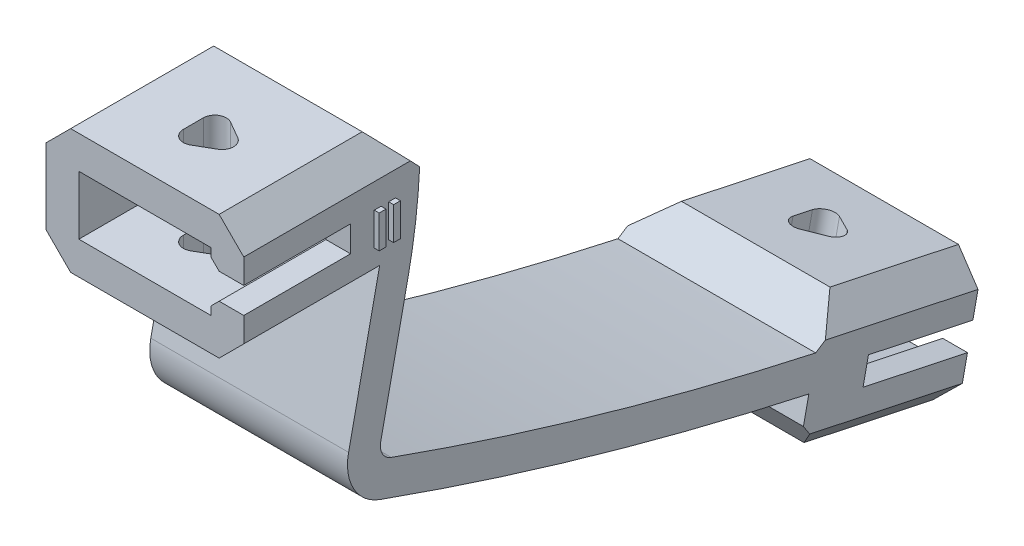
from build123d import *

# Parameters (mm, degrees)
SKETCH1_W                      = 12.04
SKETCH1_H                      = 7.58
SKETCH1_W_2                    = 8.04
SKETCH1_H_2                    = 3.58
BOSS_EXTRUDE1_DEPTH            = 8
SKETCH1_2_W                    = 12.04
SKETCH1_2_H                    = 7.58
SKETCH1_2_W_2                  = 8.04
SKETCH1_2_H_2                  = 3.58
BOSS_EXTRUDE2_DEPTH            = 2
EXTRUDE_THIN1_DEPTH            = 12.04
SKETCH5_W                      = 12.04
SKETCH5_H                      = 7.58
SKETCH5_W_2                    = 8.04
SKETCH5_H_2                    = 3.58
BOSS_EXTRUDE4_DEPTH            = 8
SKETCH5_4_W                    = 12.04
SKETCH5_4_H                    = 7.58
BOSS_EXTRUDE5_DEPTH            = 2
CHAMFER1_SIZE                  = 1.5
CHAMFER2_START                 = -7
CHAMFER2_DEPTH                 = 14
CUT_EXTRUDE1_REACH             = 50.973
CUT_EXTRUDE1_DIRECTION_2_DEPTH = 49.973440368
CUT_EXTRUDE2_DEPTH             = 48.541116576
CUT_EXTRUDE2_DEPTH_BACK        = 48.541116576
SKETCH8_W                      = 2
SKETCH8_H                      = 1.58
CUT_EXTRUDE3_DEPTH             = 6.5
SKETCH9_W                      = 4
SKETCH9_H                      = 1.58
CUT_EXTRUDE4_DEPTH             = 6.5
CHAMFER3_SIZE                  = 0.5
SKETCH10_W                     = 0.414634146
SKETCH10_H                     = 2
SKETCH10_W_2                   = 0.414634147
BOSS_EXTRUDE6_DEPTH            = 0.3


with BuildPart() as part:
    # Sketch1 → Boss-Extrude1 (new body)
    with BuildSketch(Plane.XY):
        Rectangle(SKETCH1_W, SKETCH1_H)
        Rectangle(SKETCH1_W_2, SKETCH1_H_2, mode=Mode.SUBTRACT)
    extrude(amount=BOSS_EXTRUDE1_DEPTH)

    # Sketch1<2> → Boss-Extrude2 (add)
    # profile 1 of 2: a face of its own
    with BuildSketch(Plane.XY):
        Rectangle(SKETCH1_2_W, SKETCH1_2_H)
        Rectangle(SKETCH1_2_W_2, SKETCH1_2_H_2, mode=Mode.SUBTRACT)
    # profile 2 of 2: a face of its own
    with BuildSketch(Plane.XY):
        Rectangle(SKETCH1_2_W_2, SKETCH1_2_H_2)
    extrude(amount=-BOSS_EXTRUDE2_DEPTH)

    # Sketch3 → Extrude-Thin1 (add)
    with BuildSketch(Plane(origin=(6.02, 9.81, 0), x_dir=(0, -1, 0), z_dir=(1, 0, 0))):
        with BuildLine():
            Line((6.02, 2.744137986), (6.52, 2.744137986))
            ThreePointArc((6.52, 2.744137986), (10.07949931, 2.557592532), (13.6, 2))
            Line((13.6, 2), (21.425180806, 0.336706473))
            ThreePointArc((21.425180806, 0.336706473), (22.120268588, 0.441550315), (22.574623539, 0.977927827))
            ThreePointArc((22.574623539, 0.977927827), (26.849152106, 14.317688881), (30.219561316, 27.914054616))
            Line((30.219561316, 27.914054616), (30.401286915, 28.769006338))
            Line((30.401286915, 28.769006338), (32.357582116, 28.353182957))
            Line((32.357582116, 28.353182957), (32.175856518, 27.498231234))
            ThreePointArc((32.175856518, 27.498231234), (28.773161162, 13.771621897), (24.457685624, 0.304075332))
            ThreePointArc((24.457685624, 0.304075332), (23.094620772, -1.305057203), (21.009357424, -1.619588728))
            Line((21.009357424, -1.619588728), (13.184176618, 0.043704799))
            ThreePointArc((13.184176618, 0.043704799), (9.870442383, 0.568548741), (6.52, 0.744137986))
            Line((6.52, 0.744137986), (6.02, 0.744137986))
            Line((6.02, 0.744137986), (6.02, 2.744137986))
        make_face()
    extrude(amount=-EXTRUDE_THIN1_DEPTH)



with BuildPart() as body_2:
    # Sketch5 → Boss-Extrude4 (new body)
    with BuildSketch(Plane(origin=(0, 484.189145571, -136.063399466), x_dir=(1, 0, 0), z_dir=(0, -0.20791169081775487, -0.9781476007338067))):
        with Locations((0, 517.847527624)):
            Rectangle(SKETCH5_W, SKETCH5_H)
        with Locations((0, 517.847527624)):
            Rectangle(SKETCH5_W_2, SKETCH5_H_2, mode=Mode.SUBTRACT)
    extrude(amount=BOSS_EXTRUDE4_DEPTH)


with BuildPart() as part_1:
    add(part.part)

    add(body_2.part)  # Boss-Extrude5 merges body 2
    # Sketch5<4> → Boss-Extrude5 (add)
    with BuildSketch(Plane(origin=(0, 484.189145571, -136.063399466), x_dir=(1, 0, 0), z_dir=(0, -0.20791169081775487, -0.9781476007338067))):
        with Locations((0, 517.847527624)):
            Rectangle(SKETCH5_4_W, SKETCH5_4_H)
    extrude(amount=-BOSS_EXTRUDE5_DEPTH)

    # Chamfer1
    chamfer1_edges = [part_1.edges().sort_by_distance(p)[0] for p in [
        (6.02, -26.673085599, -30.543301906),
        (-6.02, -26.673085599, -30.543301906),
        (6.02, 3.79, 2.627931007),
        (6.02, -3.79, 4.022340595),
        (-6.02, -3.79, 4.022340595),
        (-6.02, 3.79, 2.627931007),
        (6.02, -19.258726786, -32.119272522),
        (-6.02, -19.258726786, -32.119272522),
    ]]
    chamfer(chamfer1_edges, length=CHAMFER1_SIZE)

    # Chamfer2: read off the stored shape, not the designer's step
    # Chamfer2 outline → Chamfer2 (cut)
    with BuildSketch(Plane.YZ.offset(CHAMFER2_START)):
        with BuildLine():
            Line((3.79, -2.744137986), (3.79, -0.709020541))
            Line((3.79, -0.709020541), (1.696404781, -2.706829325))
            ThreePointArc((1.696404781, -2.706829325), (2.492984056, -2.734809543), (3.29, -2.744137986))
            Line((3.29, -2.744137986), (3.79, -2.744137986))
        make_face()
        Polygon((-25.633527145, -25.652563902), (-26.049350527, -27.608859104), (-23.677231944, -26.068387284), align=None)
        with BuildLine():
            ThreePointArc((-20.172493797, -26.813342374), (-20.172815684, -26.814817596), (-20.173137561, -26.81629282))
            Line((-20.173137561, -26.81629282), (-18.634991713, -29.18482972))
            Line((-18.634991713, -29.18482972), (-18.219168332, -27.228534519))
            Line((-18.219168332, -27.228534519), (-20.172493797, -26.813342374))
        make_face()
    extrude(amount=CHAMFER2_DEPTH, mode=Mode.SUBTRACT)

    # Cut-Extrude1: up to this face of the body (flat: up to its plane)
    cut_extrude1_end = Plane(part_1.part.faces().sort_by_distance((0, -3.79, 4.022340595))[0])
    # Sketch6 → Cut-Extrude1 (cut, up to the picked face)
    with BuildSketch(Plane(origin=(0, 3.79, 0), x_dir=(1, 0, 0), z_dir=(0, 1, 0)), mode=Mode.PRIVATE) as cut_extrude1_sk1:
        with BuildLine():
            Line((1.05, -3.393782217), (0, -2.787564435))
            ThreePointArc((0, -2.787564435), (-0.7, -2.787564435), (-1.05, -3.393782217))
            Line((-1.05, -3.393782217), (-1.05, -4.606217783))
            ThreePointArc((-1.05, -4.606217783), (-0.7, -5.212435565), (0, -5.212435565))
            Line((0, -5.212435565), (1.05, -4.606217783))
            ThreePointArc((1.05, -4.606217783), (1.4, -4), (1.05, -3.393782217))
        make_face()
    cut_extrude1_tool1 = split(extrude(cut_extrude1_sk1.sketch, amount=-CUT_EXTRUDE1_REACH, mode=Mode.PRIVATE), bisect_by=cut_extrude1_end, keep=Keep.BOTH, mode=Mode.PRIVATE)
    add(cut_extrude1_tool1.solids().sort_by(Axis((0, 3.79, 4), (0, -1, 0)))[0], mode=Mode.SUBTRACT)

    # Sketch6 → Cut-Extrude1 direction 2 (cut)
    with BuildSketch(Plane(origin=(0, 3.79, 0), x_dir=(1, 0, 0), z_dir=(0, 1, 0))):
        with BuildLine():
            Line((1.05, -3.393782217), (0, -2.787564435))
            ThreePointArc((0, -2.787564435), (-0.7, -2.787564435), (-1.05, -3.393782217))
            Line((-1.05, -3.393782217), (-1.05, -4.606217783))
            ThreePointArc((-1.05, -4.606217783), (-0.7, -5.212435565), (0, -5.212435565))
            Line((0, -5.212435565), (1.05, -4.606217783))
            ThreePointArc((1.05, -4.606217783), (1.4, -4), (1.05, -3.393782217))
        make_face()
    extrude(amount=CUT_EXTRUDE1_DIRECTION_2_DEPTH, mode=Mode.SUBTRACT)

    # Sketch7 → Cut-Extrude2 (cut, two sides: drawn at the far end of the back side and taken through both)
    with BuildSketch(Plane(origin=(0, -19.308540852, 4.104157054), x_dir=(1, 0, 0), z_dir=(0, -0.9781476007338067, 0.2079116908177549)).offset(-CUT_EXTRUDE2_DEPTH_BACK)):
        with BuildLine():
            Line((1.05, -35.815286021), (0, -35.209068239))
            ThreePointArc((0, -35.209068239), (-0.7, -35.209068239), (-1.05, -35.815286021))
            Line((-1.05, -35.815286021), (-1.05, -37.027721587))
            ThreePointArc((-1.05, -37.027721587), (-0.7, -37.633939369), (0, -37.633939369))
            Line((0, -37.633939369), (1.05, -37.027721587))
            ThreePointArc((1.05, -37.027721587), (1.4, -36.421503804), (1.05, -35.815286021))
        make_face()
    extrude(amount=CUT_EXTRUDE2_DEPTH + CUT_EXTRUDE2_DEPTH_BACK, mode=Mode.SUBTRACT)

    # Sketch8 → Cut-Extrude3 (cut)
    with BuildSketch(Plane.XY.offset(8)):
        with Locations((5.02, 0)):
            Rectangle(SKETCH8_W, SKETCH8_H)
    extrude(amount=-CUT_EXTRUDE3_DEPTH, mode=Mode.SUBTRACT)

    # Sketch9 → Cut-Extrude4 (cut)
    with BuildSketch(Plane(origin=(0, -8.404103201, -39.538196964), x_dir=(-1, 0, 0), z_dir=(0, -0.20791169081775673, -0.9781476007338064))):
        with Locations((-6.02, -15.949905141)):
            Rectangle(SKETCH9_W, SKETCH9_H)
    extrude(amount=-CUT_EXTRUDE4_DEPTH, mode=Mode.SUBTRACT)

    # Chamfer3
    chamfer3_edges = [part_1.edges().sort_by_distance(p)[0] for p in [
        (4.02, -0.79, 4.75),
        (4.02, 0.79, 4.75),
        (4.02, 0, 1.5),
        (4.02, -24.102488256, -32.87879528),
        (4.02, -22.654038656, -29.864065813),
        (4.02, -22.557015047, -33.207295751),
    ]]
    chamfer(chamfer3_edges, length=CHAMFER3_SIZE)

    # Sketch10 → Boss-Extrude6 (add)
    with BuildSketch(Plane(origin=(6.02, 0, 0), x_dir=(0, 0, -1), z_dir=(1, 0, 0))):
        with Locations((0.149293265, -0.21)):
            Rectangle(SKETCH10_W, SKETCH10_H)
        with Locations((1.027342045, -0.21)):
            Rectangle(SKETCH10_W_2, SKETCH10_H)
    extrude(amount=BOSS_EXTRUDE6_DEPTH)


solid = part_1.part
